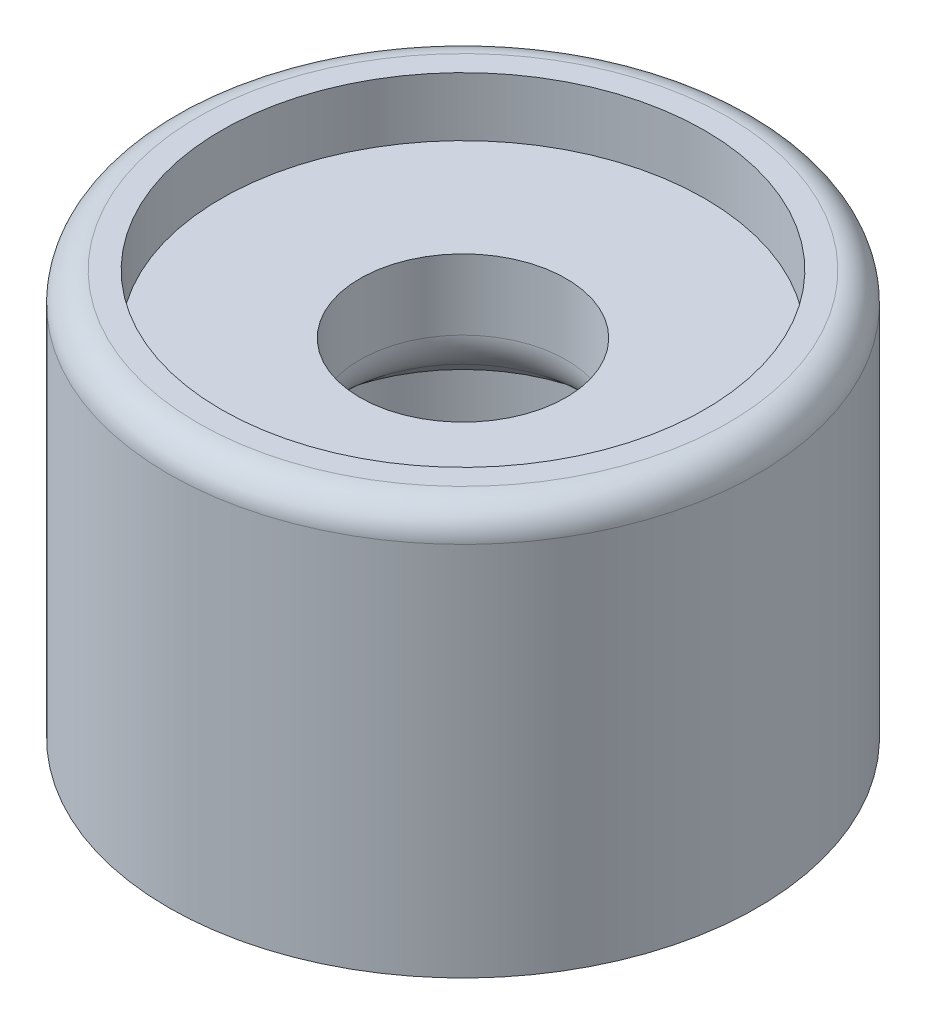
from build123d import *
from build123d.topology import SkipClean

# Parameters (mm, degrees)
CROQUIS1_R              = 6
CROQUIS1_R_2            = 3.175
SALIENTE_EXTRUIR1_DEPTH = 4.25
CROQUIS3_R              = 6
CROQUIS3_R_2            = 2.1
SALIENTE_EXTRUIR2_DEPTH = 3
REDONDEO1_R             = 0.6
CROQUIS4_R              = 4.925
CORTAR_EXTRUIR1_DEPTH   = 1.2
CHAFL_N1_SIZE           = 1
REDONDEO2_R             = 1


with BuildPart() as part:
    # Croquis1 → Saliente-Extruir1 (new body)
    with BuildSketch(Plane(origin=(0, 0, 0), x_dir=(1, 0, 0), z_dir=(0, 1, 0))):
        Circle(CROQUIS1_R)
        Circle(CROQUIS1_R_2, mode=Mode.SUBTRACT)
    extrude(amount=SALIENTE_EXTRUIR1_DEPTH)

    # Croquis2 → Revolución1 (revolve)
    with SkipClean():  # the faces are left unmerged after this step: merging them gives an invalid solid
        with BuildSketch(Plane.XY):
            Polygon((-6, 4.25), (-6, 5.25), (-2.1, 5.25), (-2.1, 5.15), (-3.175, 4.25), align=None)
        revolve(axis=Axis((0, 0, 0), (0, 1, 0)))

    # Croquis3 → Saliente-Extruir2 (add)
    with BuildSketch(Plane(origin=(0, 5.25, 0), x_dir=(1, 0, 0), z_dir=(0, 1, 0))):
        Circle(CROQUIS3_R)
        Circle(CROQUIS3_R_2, mode=Mode.SUBTRACT)
    extrude(amount=SALIENTE_EXTRUIR2_DEPTH)

    # Redondeo1
    redondeo1_edges = [part.edges().sort_by_distance(p)[0] for p in [
        (-6, 8.25, 0),
    ]]
    fillet(redondeo1_edges, radius=REDONDEO1_R)

    # Croquis4 → Cortar-Extruir1 (cut)
    with BuildSketch(Plane(origin=(0, 8.25, 0), x_dir=(1, 0, 0), z_dir=(0, 1, 0))):
        Circle(CROQUIS4_R)
    extrude(amount=-CORTAR_EXTRUIR1_DEPTH, mode=Mode.SUBTRACT)

    # Chaflán1
    chafl_n1_edges = [part.edges().sort_by_distance(p)[0] for p in [
        (-3.175, 0, 0),
    ]]
    chamfer(chafl_n1_edges, length=CHAFL_N1_SIZE)

    # Redondeo2
    redondeo2_edges = [part.edges().sort_by_distance(p)[0] for p in [
        (2.1, 5.15, 0),
    ]]
    fillet(redondeo2_edges, radius=REDONDEO2_R)


solid = part.part
